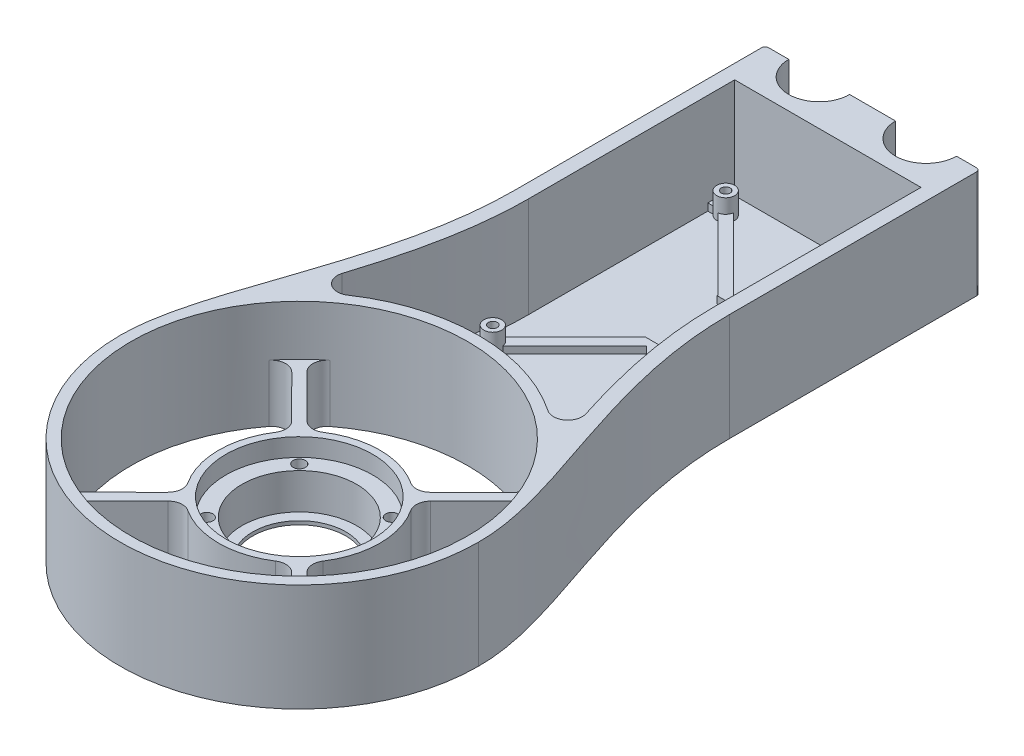
from build123d import *
from build123d.topology import SkipClean

# Parameters (mm, degrees)
EXTRUDE_1_DEPTH            = 30
CUT_EXTRUDE_1_DEPTH        = 209.32703380700454
SKETCH_3_R                 = 22.499999999999996
SKETCH_3_R_2               = 13.000000000000005
EXTRUDE_2_DEPTH            = 16
SKETCH_4_R                 = 20.499999999999996
CUT_EXTRUDE_2_DEPTH        = 5
SKETCH_5_R                 = 16.000000000000007
CUT_EXTRUDE_3_DEPTH        = 10
HOLE_WIZARD_M31_AT_2_COUNT = 2
HOLE_WIZARD_M31_AT_2_PITCH = 25.809397513308994
HOLE_WIZARD_M31_AT_3_COUNT = 2
HOLE_WIZARD_M31_AT_3_PITCH = 36.500000000000036
HOLE_WIZARD_M31_AT_4_COUNT = 2
HOLE_WIZARD_M31_AT_4_PITCH = 25.809397513308866
EXTRUDE_3_DEPTH            = 16
EXTRUDE_4_DEPTH            = 16
FILLET_1_R                 = 4
FILLET_2_R                 = 4
EXTRUDE_5_DEPTH            = 30
EXTRUDE_6_DEPTH            = 14
EXTRUDE_START              = -30
EXTRUDE_7_DEPTH            = 30
CUT_EXTRUDE_4_DEPTH        = 209.32703380700454
EXTRUDE_9_DEPTH            = 30
EXTRUDE_10_DEPTH           = 2
SKETCH_19_R                = 2.4999999999999996
SKETCH_19_R_2              = 2.5000000000000027
SKETCH_19_R_3              = 2.5
EXTRUDE_11_DEPTH           = 6
M3X0_51_D                  = 2.5
M3X0_51_DEPTH              = 6
M3X0_51_TIP                = 0.7510757737844503
EXTRUDE_12_DEPTH           = 2
CUT_EXTRUDE_5_DEPTH        = 209.32703380700454
SKETCH_24_W                = 52.00000000000009
SKETCH_24_H                = 1.5
EXTRUDE_14_DEPTH           = 28
EXTRUDE_15_DEPTH           = 20
FILLET_3_R                 = 1
M4X0_71_D                  = 3.3
M4X0_71_DEPTH              = 11
M4X0_71_TIP                = 0.9914200213954745


with BuildPart() as part:
    # Эскиз1 → Бобышка-Вытянуть1 (new body)
    with BuildSketch(Plane(origin=(0, 0, 0), x_dir=(1, 0, 0), z_dir=(0, 1, 0))):
        with BuildLine():
            Line((0, 0), (8.1, 0))
            ThreePointArc((8.1, 0), (15.1, -6.999999999999998), (22.099999999999998, 0))
            Line((22.099999999999998, 0), (37.900000000000006, 0))
            ThreePointArc((37.900000000000006, 0), (44.9, -6.999999999999993), (51.9, 0))
            Line((51.9, 0), (60, 0))
            Line((60, 0), (60, -50))
            add(Edge.make_bspline(
                [(60, -50), (60, -86.11635365077277), (80.16072899532094, -116.64260839857457), (80, -140)],
                knots=[0, 0, 0, 0, 1, 1, 1, 1], degree=3))
            ThreePointArc((80, -140), (29.99999999999999, -190), (-20.000000000000004, -140))
            add(Edge.make_bspline(
                [(0, -50), (0, -86.11635365077277), (-20.160728995320937, -116.64260839857457), (-20.000000000000004, -140)],
                knots=[0, 0, 0, 0, 1, 1, 1, 1], degree=3))
            Line((0, -50), (0, 0))
        make_face()
    extrude(amount=EXTRUDE_1_DEPTH)

    # Эскиз2 → Вырез-Вытянуть1 (cut, through all)
    with BuildSketch(Plane.XZ):
        with BuildLine():
            Line((2.9999999999996114, 50.000000000000114), (3, 3))
            Line((3, 3), (5.560607985830544, 3.0000000000000004))
            ThreePointArc((5.560607985830544, 3.0000000000000004), (15.1, 9.999999999999996), (24.639392014169452, 3))
            Line((24.639392014169452, 3), (35.36060798583055, 3.000000000000001))
            ThreePointArc((35.36060798583055, 3.000000000000001), (44.9, 9.999999999999995), (54.43939201416945, 3))
            Line((54.43939201416945, 3), (56.99999999999999, 3.0000000000000004))
            Line((56.99999999999999, 3.0000000000000004), (56.99999999999994, 49.99999999999999))
            add(Edge.make_bspline(
                [(56.99999999999994, 49.99999999999999), (56.99999999999994, 51.15761948444893), (57.04060731241555, 53.48144141430456), (57.273709046009905, 58.05633087995577), (57.8300620642797, 63.68575205723362), (58.85825492315023, 70.27885975955536), (60.62587825488197, 78.85472959222419), (63.42250232474483, 89.16282329635918), (67.22345269691876, 100.85676130834415), (70.98278726548295, 111.85118912341512), (73.6804257047586, 120.39952498600648), (75.34438659158211, 126.83896525591926), (76.29021877948448, 131.46025334650096), (76.78342190294313, 135.1232258543713), (76.97775852866553, 137.94836696867148), (77.00490381654205, 139.3043913040805), (76.99999885765412, 139.98963754557798)],
                knots=[0, 0, 0, 0, 0.0312549553320896, 0.0625099106641792, 0.1250198213283584, 0.18752973199253758, 0.2500396426567168, 0.37505946398507517, 0.5000792853134336, 0.6250991066417919, 0.7501189279701503, 0.8126288386343296, 0.8751387492985088, 0.937648659962688, 0.9689036152947776, 1.0001585706268672, 1.0001585706268672, 1.0001585706268672, 1.0001585706268672], degree=3))
            ThreePointArc((76.99999885765412, 139.98963754557798), (30.00000000005947, 186.99999999999946), (-16.999998857654578, 139.98963754569692))
            add(Edge.make_bspline(
                [(-16.999998857654578, 139.98963754569692), (-17.0049038165447, 139.30439130419938), (-16.977758528671707, 137.94836696879005), (-16.783421902957134, 135.1232258544892), (-16.290218779505096, 131.46025334661698), (-15.344386591609707, 126.83896525603217), (-13.680425704790268, 120.39952498611376), (-10.982787265517556, 111.85118912351331), (-7.223452696947435, 100.85676130842775), (-3.422502324765512, 89.16282329642603), (-0.6258782548946378, 78.85472959227457), (1.141745076844117, 70.27885975959141), (2.1699379357163426, 63.68575205725832), (2.7262909539885007, 58.056330879970524), (2.9593926875830268, 53.48144141431117), (2.999999999999611, 51.15761948445119), (2.9999999999996114, 50.000000000000114)],
                knots=[-0.00015857062870074, -0.00015857062870074, -0.00015857062870074, -0.00015857062870074, 0.03109638470344616, 0.06235134003559305, 0.12486125069988685, 0.18737116136418064, 0.24988107202847445, 0.37490089335706206, 0.49992071468564964, 0.6249405360142373, 0.7499603573428248, 0.8124702680071186, 0.8749801786714124, 0.9374900893357062, 0.9687450446678532, 1, 1, 1, 1], degree=3))
        make_face()
    extrude(amount=-CUT_EXTRUDE_1_DEPTH, mode=Mode.SUBTRACT)

    # Эскиз9 → Бобышка-Вытянуть3 (add)
    with SkipClean():  # the faces are left unmerged after this step: merging them gives an invalid solid
        with BuildSketch(Plane.XZ):
            with BuildLine():
                ThreePointArc((-10.590299410955694, 110.80363699425222), (29.999999999999805, 89.99999980965572), (70.59029941095437, 110.80363699425268))
                add(Edge.make_bspline(
                    [(70.59029941095437, 110.80363699425268), (70.69273970529326, 111.11282998358703), (71.96821202817121, 114.973824727998), (73.6804257047586, 120.39952498600648), (75.34438659158211, 126.83896525591926), (76.29021877948448, 131.46025334650096), (76.78342190294313, 135.1232258543713), (76.97775852866553, 137.94836696867148), (77.00490381654205, 139.3043913040805), (76.99999885765412, 139.98963754557798)],
                    knots=[0.6142510234253292, 0.6142510234253292, 0.6142510234253292, 0.6142510234253292, 0.6250991066417919, 0.7501189279701503, 0.8126288386343296, 0.8751387492985088, 0.937648659962688, 0.9689036152947776, 1.0001585706268672, 1.0001585706268672, 1.0001585706268672, 1.0001585706268672], degree=3))
                ThreePointArc((76.99999885765412, 139.98963754557798), (29.999999999940506, 93.00000000000031), (-16.999998857654358, 139.98963754569695))
                add(Edge.make_bspline(
                    [(-16.999998857654358, 139.98963754569695), (-17.0049038165447, 139.30439130419938), (-16.977758528671707, 137.94836696879005), (-16.783421902957134, 135.1232258544892), (-16.290218779505096, 131.46025334661698), (-15.344386591609707, 126.83896525603217), (-13.680425704790268, 120.39952498611376), (-11.96821202819517, 114.9738247280692), (-10.692739705305403, 111.11282998362088), (-10.590299410955694, 110.80363699425222)],
                    knots=[-0.00015857062870074, -0.00015857062870074, -0.00015857062870074, -0.00015857062870074, 0.03109638470344616, 0.06235134003559305, 0.12486125069988685, 0.18737116136418064, 0.24988107202847445, 0.37490089335706206, 0.3857489765746526, 0.3857489765746526, 0.3857489765746526, 0.3857489765746526], degree=3))
            make_face()
        extrude(amount=-EXTRUDE_3_DEPTH)



with BuildPart() as body_2:
    # Эскиз3 → Бобышка-Вытянуть2 (new body)
    with BuildSketch(Plane.XZ):
        with Locations(Location((30, 140, 0), (0, 0, 270))):
            Circle(SKETCH_3_R)
        with Locations(Location((30, 140, 0), (0, 0, 270))):
            Circle(SKETCH_3_R_2, mode=Mode.SUBTRACT)
    extrude(amount=-EXTRUDE_2_DEPTH)

    # Эскиз4 → Вырез-Вытянуть2 (cut)
    with BuildSketch(Plane(origin=(0, 16, 0), x_dir=(1, 0, 0), z_dir=(0, 1, 0))):
        with Locations(Location((30, -140, 0), (0, 0, 270))):
            Circle(SKETCH_4_R)
    extrude(amount=-CUT_EXTRUDE_2_DEPTH, mode=Mode.SUBTRACT)

    # Эскиз5 → Вырез-Вытянуть3 (cut)
    with BuildSketch(Plane(origin=(0, 11, 0), x_dir=(1, 0, 0), z_dir=(0, 1, 0))):
        with Locations(Location((30, -140, 0), (0, 0, 270))):
            Circle(SKETCH_5_R)
    extrude(amount=-CUT_EXTRUDE_3_DEPTH, mode=Mode.SUBTRACT)

    # Эскиз7 → Отверстие с зазором M31 (revolve, cut)
    with BuildSketch(Plane(origin=(17.09530124334549, 11, 127.0953012433455), x_dir=(0, 0, 1), z_dir=(1, 0, 0))):
        Polygon((0, 0), (-2.69e-15, 11), (1.6999999999999966, 11), (1.699999999999988, -1.35e-15), align=None)
    hole_wizard_m31 = revolve(axis=Axis((17.09530124334549, 17.34999999999999, 127.0953012433455), (0, -1, 0)), mode=Mode.SUBTRACT)

    # Отверстие с зазором M31 at 2: Отверстие с зазором M31 ×2
    with Locations(*[(i * HOLE_WIZARD_M31_AT_2_PITCH, 0, 0) for i in range(1, HOLE_WIZARD_M31_AT_2_COUNT)]):
        add(hole_wizard_m31, mode=Mode.SUBTRACT)

    # Отверстие с зазором M31 at 3: Отверстие с зазором M31 ×2
    with Locations(*[Vector(0.7071067811865477, 0, 0.7071067811865475) * (i * HOLE_WIZARD_M31_AT_3_PITCH) for i in range(1, HOLE_WIZARD_M31_AT_3_COUNT)]):
        add(hole_wizard_m31, mode=Mode.SUBTRACT)

    # Отверстие с зазором M31 at 4: Отверстие с зазором M31 ×2
    with Locations(*[(0, 0, i * HOLE_WIZARD_M31_AT_4_PITCH) for i in range(1, HOLE_WIZARD_M31_AT_4_COUNT)]):
        add(hole_wizard_m31, mode=Mode.SUBTRACT)


with BuildPart() as part_1:
    with SkipClean():  # the faces are left unmerged after this step: merging them gives an invalid solid
        add(part.part)

        add(body_2.part)  # Бобышка-Вытянуть4 merges body 2
        # Эскиз10 → Бобышка-Вытянуть4 (add)
        with BuildSketch(Plane.XZ):
            with BuildLine():
                Line((13.061566249620322, 154.8101135067898), (-4.284838091164062, 172.14887054101078))
                ThreePointArc((-4.284838091164062, 172.14887054101078), (-3.2412744710281274, 173.22676137606223), (-2.163839456664804, 174.27079560509063))
                Line((-2.163839456664804, 174.27079560509063), (15.182490993971593, 156.93196464844726))
                ThreePointArc((15.182490993971593, 156.93196464844726), (14.086623923443979, 155.90642831832764), (13.061566249620322, 154.8101135067898))
            make_face()
            with BuildLine():
                Line((15.189886493210187, 123.06156624962034), (-2.148870541010764, 105.71516190883595))
                ThreePointArc((-2.148870541010764, 105.71516190883595), (-3.2267613760621217, 106.75872552897181), (-4.270795605090482, 107.83616054333508))
                Line((-4.270795605090482, 107.83616054333508), (13.06803535155281, 125.18249099397156))
                ThreePointArc((13.06803535155281, 125.18249099397156), (14.093571681672403, 124.08662392344398), (15.189886493210187, 123.06156624962034))
            make_face()
            with BuildLine():
                Line((44.81011350678981, 156.9384337503797), (62.148870541010766, 174.28483809116406))
                ThreePointArc((62.148870541010766, 174.28483809116406), (63.226761376062264, 173.2412744710281), (64.27079560509073, 172.1638394566647))
                Line((64.27079560509073, 172.1638394566647), (46.931964648447305, 154.81750900602833))
                ThreePointArc((46.931964648447305, 154.81750900602833), (45.906428318327656, 155.91337607655598), (44.81011350678981, 156.9384337503797))
            make_face()
            with BuildLine():
                Line((46.93843375037968, 125.18988649321022), (64.28483809116408, 107.85112945898926))
                ThreePointArc((64.28483809116408, 107.85112945898926), (63.24127447102802, 106.77323862393771), (62.163839456664554, 105.72920439490919))
                Line((62.163839456664554, 105.72920439490919), (44.81750900602827, 123.06803535155267))
                ThreePointArc((44.81750900602827, 123.06803535155267), (45.91337607655595, 124.09357168167234), (46.93843375037968, 125.18988649321022))
            make_face()
        extrude(amount=-EXTRUDE_4_DEPTH)

    # Скругление1
    fillet_1_edges = [part_1.edges().sort_by_distance(p)[0] for p in [
        (70.59029941095437, 8, 110.80363699425268),
        (-10.590299410955694, 8, 110.80363699425222),
    ]]
    fillet(fillet_1_edges, radius=FILLET_1_R)

    # Скругление2
    fillet_2_edges = [part_1.edges().sort_by_distance(p)[0] for p in [
        (13.068035351552812, 8, 125.18249099397156),
        (-4.270795605090485, 8, 107.83616054333507),
        (13.06156624962032, 8, 154.8101135067898),
        (-4.284838091164065, 8, 172.14887054101078),
        (-2.163839456664807, 8, 174.27079560509063),
        (15.18249099397159, 8, 156.93196464844726),
        (44.81011350678982, 8, 156.9384337503797),
        (62.148870541010766, 8, 174.28483809116406),
        (46.931964648447305, 8, 154.81750900602833),
        (64.27079560509073, 8, 172.1638394566647),
        (46.93843375037968, 8, 125.18988649321022),
        (64.28483809116409, 8, 107.85112945898926),
        (44.81750900602827, 8, 123.06803535155267),
        (15.189886493210189, 8, 123.06156624962034),
        (-2.1488705410107665, 8, 105.71516190883595),
        (62.16383945666456, 8, 105.72920439490917),
    ]]
    fillet(fillet_2_edges, radius=FILLET_2_R)

    # Эскиз11 → Бобышка-Вытянуть5 (add, through all)
    with BuildSketch(Plane(origin=(0, 30, 0), x_dir=(1, 0, 0), z_dir=(0, 1, 0))):
        with BuildLine():
            ThreePointArc((24.639392014169456, -3.000000000000001), (21.016079755907775, -8.062257768251904), (15.099999932545344, -9.999999999999998))
            Line((15.099999932545344, -9.999999999999998), (44.90000001649191, -9.999999999999998))
            ThreePointArc((44.90000001649191, -9.999999999999995), (38.98392022354849, -8.062257753176917), (35.36060798583055, -3.0000000000000004))
            Line((35.36060798583055, -3.000000000000001), (24.639392014169452, -2.9999999999999996))
        make_face()
        with BuildLine():
            ThreePointArc((54.43939201416945, -3.0000000000000013), (50.81607978974771, -8.062257743420174), (44.90000001649191, -9.999999999999995))
            Line((44.90000001649191, -9.999999999999998), (56.99999999999999, -9.999999999999998))
            Line((56.99999999999999, -9.999999999999998), (56.99999999999999, -3.0000000000000004))
            Line((56.99999999999999, -3.0000000000000004), (54.43939201416945, -3.0000000000000004))
        make_face()
        with BuildLine():
            Line((3.000000000000001, -3.0000000000000027), (3.000000000000001, -9.999999999999998))
            Line((3.000000000000001, -9.999999999999998), (15.099999932545344, -9.999999999999998))
            ThreePointArc((15.099999932545344, -9.999999999999998), (9.183920189708545, -8.062257728345193), (5.560607985830545, -3.0000000000000004))
            Line((5.560607985830544, -3.0000000000000004), (3.000000000000001, -3.0000000000000027))
        make_face()
    extrude(amount=-EXTRUDE_5_DEPTH)

    # Эскиз12 → Бобышка-Вытянуть6 (add)
    with BuildSketch(Plane(origin=(0, 16, 0), x_dir=(1, 0, 0), z_dir=(0, 1, 0))):
        with BuildLine():
            ThreePointArc((59.169351437259884, -99.39028495835034), (29.999999999999602, -89.99999980965637), (0.8306485627394624, -99.3902849583508))
            ThreePointArc((0.8306485627394624, -99.3902849583508), (-3.85522262964213, -99.3767165856445), (-5.312887214055651, -94.9233148642998))
            add(Edge.make_bspline(
                [(-5.312887214055651, -94.9233148642998), (-5.9422377396764325, -96.89165480215911), (-7.843811241520206, -102.67104176508077), (-10.982787265517556, -111.85118912351331), (-13.680425704790268, -120.39952498611376), (-15.344386591609707, -126.83896525603217), (-16.290218779505096, -131.46025334661698), (-16.783421902957134, -135.1232258544892), (-16.977758528671707, -137.94836696879005), (-17.0049038165447, -139.30439130419938), (-16.999998857654905, -139.98963754569692)],
                knots=[-0.00015857062870074, -0.00015857062870074, -0.00015857062870074, -0.00015857062870074, 0.06296962095463947, 0.18798944228322703, 0.3130092636118147, 0.3755191742761085, 0.43802908494040227, 0.5005389956046961, 0.531793950936843, 0.5630489062689898, 0.5630489062689898, 0.5630489062689898, 0.5630489062689898], degree=3))
            ThreePointArc((-16.999998857654905, -139.98963754569692), (29.99999999994054, -93.00000000000054), (76.99999885765412, -139.98963754557798))
            add(Edge.make_bspline(
                [(76.99999885765412, -139.98963754557798), (77.00490381654205, -139.3043913040805), (76.97775852866553, -137.94836696867148), (76.78342190294313, -135.1232258543713), (76.29021877948448, -131.46025334650096), (75.34438659158211, -126.83896525591926), (73.6804257047586, -120.39952498600648), (70.98278726548295, -111.85118912341512), (67.84381124149854, -102.6710417650181), (65.94223773966665, -96.8916548021302), (65.31288721405492, -94.92331486429931)],
                knots=[0.43695109373100594, 0.43695109373100594, 0.43695109373100594, 0.43695109373100594, 0.4682060490630955, 0.49946100439518515, 0.5619709150593644, 0.6244808257235436, 0.6869907363877228, 0.8120105577160812, 0.9370303790444395, 1.0001585706268672, 1.0001585706268672, 1.0001585706268672, 1.0001585706268672], degree=3))
            ThreePointArc((65.31288721405492, -94.92331486429931), (63.85522262964144, -99.37671658564399), (59.169351437259884, -99.39028495835034))
        make_face()
    extrude(amount=EXTRUDE_6_DEPTH)

    # Эскиз13 → Бобышка-Вытянуть7 (add)
    with BuildSketch(Plane(origin=(0, 30, 0), x_dir=(1, 0, 0), z_dir=(0, 1, 0)).offset(EXTRUDE_START)):
        with BuildLine():
            Line((3.9999999999992784, -50.0000000000001), (3.999999999999895, -10.999999999999996))
            Line((3.999999999999895, -10.999999999999996), (55.99999999999998, -10.999999999999996))
            Line((55.99999999999998, -10.999999999999996), (55.99999999999991, -49.99999999999998))
            add(Edge.make_bspline(
                [(55.99999999999991, -49.99999999999998), (55.99999999999991, -52.03498068113325), (56.12527058577417, -56.13193535820143), (56.819212399121525, -64.08850039677553), (58.41081044935653, -73.7477782372734), (60.67836350111951, -82.95184755755167), (62.73749964431051, -90.06762105355448), (63.80856926980304, -93.50200234801329), (64.36039029638012, -95.22786309007068)],
                knots=[0, 0, 0, 0, 0.05461888671637527, 0.10923777343275054, 0.21847554686550108, 0.3277133202982516, 0.3823322070146269, 0.43695109373100216, 0.43695109373100216, 0.43695109373100216, 0.43695109373100216], degree=3))
            Line((64.36039029638012, -95.22786309007068), (65.16614916399801, -97.74793305879278))
            ThreePointArc((65.16614916399801, -97.74793305879278), (65.49751290253572, -96.34902670789218), (65.31288721405492, -94.92331486429931))
            add(Edge.make_bspline(
                [(56.99999999999994, -49.99999999999999), (56.99999999999994, -51.15761948444893), (57.04060731241555, -53.48144141430456), (57.273709046009905, -58.05633087995577), (57.8300620642797, -63.68575205723362), (58.85825492315023, -70.27885975955536), (60.62587825488197, -78.85472959222419), (62.8576452702698, -87.08081323654591), (64.69586447452805, -92.9935309818117), (65.31288721405492, -94.92331486429931)],
                knots=[0, 0, 0, 0, 0.0312549553320896, 0.0625099106641792, 0.1250198213283584, 0.18752973199253758, 0.2500396426567168, 0.37505946398507517, 0.436951093731006, 0.436951093731006, 0.436951093731006, 0.436951093731006], degree=3))
            Line((56.99999999999994, -49.99999999999999), (56.999999999999986, -9.999999999999998))
            Line((56.999999999999986, -9.999999999999998), (2.9999999999999423, -9.999999999999995))
            Line((2.9999999999999423, -9.999999999999995), (2.9999999999996114, -50.000000000000114))
            add(Edge.make_bspline(
                [(-5.312887214055668, -94.92331486429987), (-4.695864474535626, -92.99353098183356), (-2.857645270281727, -87.08081323658317), (-0.6258782548946378, -78.85472959227457), (1.141745076844117, -70.27885975959141), (2.1699379357163426, -63.68575205725832), (2.7262909539885007, -58.056330879970524), (2.9593926875830268, -53.48144141431117), (2.999999999999611, -51.15761948445119), (2.9999999999996114, -50.000000000000114)],
                knots=[0.5630489062689893, 0.5630489062689893, 0.5630489062689893, 0.5630489062689893, 0.6249405360142373, 0.7499603573428248, 0.8124702680071186, 0.8749801786714124, 0.9374900893357062, 0.9687450446678532, 1, 1, 1, 1], degree=3))
            ThreePointArc((-5.312887214055668, -94.92331486429987), (-5.497512902536842, -96.34902670789286), (-5.166149163999231, -97.74793305879379))
            Line((-5.166149163999231, -97.74793305879379), (-4.360390296381386, -95.22786309007161))
            add(Edge.make_bspline(
                [(-4.360390296381386, -95.22786309007161), (-3.8085692698043276, -93.50200234801419), (-2.737499644311918, -90.06762105355533), (-0.6783635011204932, -82.95184755755248), (1.5891895506421023, -73.74777823727402), (3.1807876008779727, -64.08850039677573), (3.8747294142246784, -56.131935358201844), (3.99999999999928, -52.03498068113343), (3.9999999999992784, -50.0000000000001)],
                knots=[0.5630489062689885, 0.5630489062689885, 0.5630489062689885, 0.5630489062689885, 0.6176677929853649, 0.6722866797017414, 0.7815244531344943, 0.8907622265672471, 0.9453811132836236, 1, 1, 1, 1], degree=3))
        make_face()
    extrude(amount=EXTRUDE_7_DEPTH)

    # Эскиз14 → Вырез-Вытянуть4 (cut, through all)
    with BuildSketch(Plane(origin=(0, 30, 0), x_dir=(1, 0, 0), z_dir=(0, 1, 0))):
        with BuildLine():
            Line((3.9999999999992784, -50.0000000000001), (55.99999999999991, -49.99999999999998))
            add(Edge.make_bspline(
                [(55.99999999999991, -49.99999999999998), (55.99999999999991, -52.03498068113325), (56.12527058577417, -56.13193535820143), (56.819212399121525, -64.08850039677553), (58.41081044935653, -73.7477782372734), (60.67836350111951, -82.95184755755167), (62.73749964431051, -90.06762105355448), (63.80856926980304, -93.50200234801329), (64.36039029638012, -95.22786309007068)],
                knots=[0, 0, 0, 0, 0.05461888671637527, 0.10923777343275054, 0.21847554686550108, 0.3277133202982516, 0.3823322070146269, 0.43695109373100216, 0.43695109373100216, 0.43695109373100216, 0.43695109373100216], degree=3))
            Line((64.36039029638012, -95.22786309007068), (68.45994864398439, -108.0495325646643))
            ThreePointArc((68.45994864398439, -108.0495325646643), (30.00000000000027, -89.99999980965637), (-8.459948643984049, -108.04953256466388))
            Line((-8.459948643984049, -108.04953256466388), (-4.360390296381386, -95.22786309007161))
            add(Edge.make_bspline(
                [(-4.360390296381386, -95.22786309007161), (-3.8085692698043276, -93.50200234801419), (-2.737499644311918, -90.06762105355533), (-0.6783635011204932, -82.95184755755248), (1.5891895506421023, -73.74777823727402), (3.1807876008779727, -64.08850039677573), (3.8747294142246784, -56.131935358201844), (3.99999999999928, -52.03498068113343), (3.9999999999992784, -50.0000000000001)],
                knots=[0.5630489062689885, 0.5630489062689885, 0.5630489062689885, 0.5630489062689885, 0.6176677929853649, 0.6722866797017414, 0.7815244531344943, 0.8907622265672471, 0.9453811132836236, 1, 1, 1, 1], degree=3))
        make_face()
    extrude(amount=-CUT_EXTRUDE_4_DEPTH, mode=Mode.SUBTRACT)

    # Эскиз15 → Бобышка-Вытянуть9 (add)
    with BuildSketch(Plane(origin=(0, 30, 0), x_dir=(1, 0, 0), z_dir=(0, 1, 0))):
        with BuildLine():
            Line((-4.360390296381386, -95.22786309007161), (-8.459948643984049, -108.04953256466388))
            ThreePointArc((-8.459948643984049, -108.04953256466388), (-3.5312054010374823, -102.91013233526172), (2.0776304150828864, -98.52300281122487))
            ThreePointArc((2.07763041508289, -98.52300281122487), (-2.5353445930742455, -98.42034842289144), (-3.9825043477067164, -94.03904667638977))
            add(Edge.make_bspline(
                [(-4.360390296381386, -95.22786309007161), (-4.233592316694429, -94.83129310673598), (-4.107654237723681, -94.43518089835217), (-3.98250434770692, -94.03904667639037)],
                knots=[0.5630489062689885, 0.5630489062689885, 0.5630489062689885, 0.5630489062689885, 0.5755992879232479, 0.5755992879232479, 0.5755992879232479, 0.5755992879232479], degree=3))
        make_face()
        with BuildLine():
            Line((68.45994864398439, -108.04953256466429), (64.36039029638012, -95.22786309007068))
            add(Edge.make_bspline(
                [(63.98253813414828, -94.03915361981963), (64.10767690386872, -94.43525219001346), (64.23360372714463, -94.83132879375911), (64.36039029638012, -95.22786309007068)],
                knots=[0.4244018414758169, 0.4244018414758169, 0.4244018414758169, 0.4244018414758169, 0.43695109373100216, 0.43695109373100216, 0.43695109373100216, 0.43695109373100216], degree=3))
            ThreePointArc((63.982538134148065, -94.03915361981899), (62.535301459710944, -98.42038247928511), (57.922370806697025, -98.52300363372812))
            ThreePointArc((57.92237080669703, -98.52300363372812), (63.53120594731209, -102.91013282912289), (68.45994864398439, -108.04953256466429))
        make_face()
    extrude(amount=-EXTRUDE_9_DEPTH)

    # Эскиз16 → Бобышка-Вытянуть10 (add)
    with BuildSketch(Plane.XZ):
        Polygon((-7.8524647657984, 101.93517402749758), (-2.0682379994428626, 81.42746094678252), (2.4013917745591415, 58.81639267830183), (2.4013917745591415, 39.097437792998896), (2.4013917745591415, 22.53351568934444), (2.4013917745591415, 9.387545765809158), (57.35154605493661, 9.387545765809158), (57.35154605493661, 36.73116320676255), (57.35154605493661, 56.975956889006895), (62.60993402435075, 81.42746094678252), (67.0201949019239, 101.93517402749758), (62.60993402435075, 101.93517402749758), (57.35154605493661, 100.89572524284594), (53.10461288062748, 97.8523070484284), (47.493444525620525, 95.40639704359529), (40.92861683359864, 92.5447866416201), (34.93130146834046, 92.5447866416201), (28.840892836007253, 91.3408686561589), (21.73358788745398, 92.86932133326714), (13.415834781085877, 94.65808544216351), (5.092688811679992, 97.8523070484284), (-1.046943422200762, 101.93517402749758), align=None)
    extrude(amount=-EXTRUDE_10_DEPTH)

    # Эскиз19 → Бобышка-Вытянуть11 (add)
    with BuildSketch(Plane(origin=(0, 2, 0), x_dir=(1, 0, 0), z_dir=(0, 1, 0))):
        with Locations(Location((7.499999999999693, -18.499999999999996, 0), (0, 0, 90))):
            Circle(SKETCH_19_R)
        with Locations(Location((52.4999999999997, -18.499999999999996, 0), (0, 0, 90))):
            Circle(SKETCH_19_R_2)
        with Locations(Location((52.49999999999971, -63.5, 0), (0, 0, 90))):
            Circle(SKETCH_19_R_2)
        with Locations(Location((7.499999999999699, -63.5, 0), (0, 0, 90))):
            Circle(SKETCH_19_R_3)
    extrude(amount=EXTRUDE_11_DEPTH)

    # Отверстие обработанное метчиком M3x0.51
    with Locations(Plane(origin=(0, 8, 0), x_dir=(1, 0, 0), z_dir=(0, 1, 0))):
        with Locations((7.5, -18.5), (52.5, -18.5), (52.5, -63.5), (7.5, -63.5)):
            Hole(M3X0_51_D / 2, depth=M3X0_51_DEPTH)
            with Locations((0, 0, -(M3X0_51_DEPTH + M3X0_51_TIP / 2))):  # 118° drill point
                Cone(0, M3X0_51_D / 2, M3X0_51_TIP, mode=Mode.SUBTRACT)

    # Эскиз22 → Бобышка-Вытянуть12 (add)
    with BuildSketch(Plane(origin=(0, 2, 0), x_dir=(1, 0, 0), z_dir=(0, 1, 0))):
        with BuildLine():
            ThreePointArc((9.97487373415261, -18.85355339059327), (9.267766952966062, -20.267766952966365), (7.853553390592965, -20.974873734152915))
            Line((7.853553390592965, -20.974873734152915), (27.878679656440053, -41.00000000000001))
            Line((27.878679656440053, -41.00000000000001), (7.853553390592972, -61.02512626584708))
            ThreePointArc((7.853553390592972, -61.02512626584708), (9.26776695296607, -61.73223304703363), (9.974873734152618, -63.14644660940673))
            Line((9.974873734152617, -63.14644660940673), (29.999999999999694, -43.12132034355966))
            Line((29.999999999999694, -43.12132034355966), (50.02512626584679, -63.146446609406745))
            ThreePointArc((50.02512626584679, -63.146446609406745), (50.732233047033326, -61.732233047033645), (52.14644660940642, -61.025126265847085))
            Line((52.14644660940642, -61.02512626584708), (32.12132034355934, -41))
            Line((32.12132034355934, -41), (52.14644660940643, -20.97487373415292))
            ThreePointArc((52.14644660940643, -20.974873734152915), (50.73223304703333, -20.26776695296637), (50.02512626584679, -18.853553390593273))
            Line((50.02512626584679, -18.853553390593273), (29.999999999999705, -38.87867965644036))
            Line((29.99999999999971, -38.87867965644036), (9.974873734152608, -18.85355339059327))
        make_face()
        with BuildLine():
            Line((3.999999999999776, -19.999999999999996), (5.4999999999996945, -19.999999999999996))
            ThreePointArc((5.4999999999996945, -19.999999999999996), (4.9999999999996945, -18.499999999999993), (5.499999999999696, -16.999999999999993))
            Line((5.4999999999996945, -16.999999999999993), (3.999999999999776, -16.999999999999993))
            Line((3.999999999999776, -16.999999999999993), (3.999999999999776, -19.999999999999996))
        make_face()
        with BuildLine():
            ThreePointArc((5.499999999999707, -65.00000000000001), (4.999999999999698, -63.500000000000014), (5.4999999999996865, -62.000000000000014))
            Line((5.499999999999686, -62.000000000000014), (3.3150022080520247, -62.000000000000234))
            add(Edge.make_bspline(
                [(2.940902429424268, -65.00000000033711), (3.0739080344752345, -64.03161035225473), (3.199237612352327, -63.03166786483183), (3.3120087197819035, -62.02675817436333), (3.315002208008357, -62.00000000039057)],
                knots=[0.8636467637840218, 0.8636467637840218, 0.8636467637840218, 0.8636467637840218, 0.8907622265672471, 0.8915038922890043, 0.8915038922890043, 0.8915038922890043, 0.8915038922890043], degree=3))
            Line((2.9409024294705666, -65.00000000000001), (5.499999999999707, -65.00000000000001))
        make_face()
        with BuildLine():
            Line((55.999999999999964, -16.999999999999993), (54.4999999999997, -16.999999999999993))
            ThreePointArc((54.4999999999997, -16.999999999999993), (54.9999999999997, -18.499999999999996), (54.4999999999997, -20))
            Line((54.4999999999997, -19.999999999999996), (55.999999999999964, -19.999999999999996))
            Line((55.999999999999964, -19.999999999999996), (55.999999999999964, -16.999999999999993))
        make_face()
        with BuildLine():
            ThreePointArc((54.49999999999973, -62.00000000000002), (54.99999999999971, -63.50000000000002), (54.4999999999997, -65.00000000000001))
            Line((54.4999999999997, -65.00000000000001), (57.059097570528714, -65.00000000000001))
            add(Edge.make_bspline(
                [(56.684997791955496, -62.00000000007417), (56.687991280193664, -62.02675817415233), (56.80076238762177, -63.03166786461972), (56.92609196549733, -64.03161035204154), (57.05909757053132, -65.00000000001907)],
                knots=[0.10849610770807283, 0.10849610770807283, 0.10849610770807283, 0.10849610770807283, 0.10923777343275054, 0.13635323621300985, 0.13635323621300985, 0.13635323621300985, 0.13635323621300985], degree=3))
            Line((56.684997791947225, -62.000000000000206), (54.49999999999972, -62.000000000000014))
        make_face()
    extrude(amount=EXTRUDE_12_DEPTH)

    # Эскиз23 → Вырез-Вытянуть5 (cut, through all)
    with BuildSketch(Plane(origin=(0, 30, 0), x_dir=(1, 0, 0), z_dir=(0, 1, 0))):
        with BuildLine():
            Line((8.1, 0), (6.6, 1.04e-15))
            ThreePointArc((6.6, 1.04e-15), (15.099999999999998, -8.5), (23.599999999999994, 0))
            Line((23.599999999999994, 0), (22.099999999999998, 4.3e-16))
            ThreePointArc((22.099999999999998, 4.3e-16), (15.099999999999998, -7), (8.1, 0))
        make_face()
        with BuildLine():
            Line((53.39999999999999, -2.08e-15), (51.89999999999999, -4.3e-16))
            ThreePointArc((51.89999999999999, -4.3e-16), (44.9, -6.999999999999993), (37.900000000000006, 0))
            Line((37.900000000000006, 0), (36.4, 1.04e-15))
            ThreePointArc((36.4, 1.04e-15), (44.9, -8.5), (53.39999999999999, -2.08e-15))
        make_face()
    extrude(amount=-CUT_EXTRUDE_5_DEPTH, mode=Mode.SUBTRACT)

    # Эскиз24 → Бобышка-Вытянуть14 (add)
    with BuildSketch(Plane(origin=(0, 2, 0), x_dir=(1, 0, 0), z_dir=(0, 1, 0))):
        with Locations((29.99999999999994, -11.749999999999996)):
            Rectangle(SKETCH_24_W, SKETCH_24_H)
    extrude(amount=EXTRUDE_14_DEPTH)


with BuildPart() as body_2_2:
    # Split Bodies 1: the piece on the far side of the plane
    add(part_1.part)
    split(bisect_by=Plane(origin=(0, 0, 41.123183465185825), x_dir=(-1, 0, 0), z_dir=(0, 0, -1)), keep=Keep.BOTTOM)


with BuildPart() as part_2:
    add(part_1.part)

    # Split Bodies 1
    split(bisect_by=Plane(origin=(0, 0, 41.123183465185825), x_dir=(-1, 0, 0), z_dir=(0, 0, -1)), keep=Keep.TOP)


with BuildPart() as part_3:
    # Move Body 1: read off the stored shape, not the designer's step
    # Move Body 1: moved
    add(part_2.part.moved(Location((0, 0, -20))))


    add(body_2_2.part)  # Бобышка-Вытянуть15 merges body 2 2
    # Эскиз27 → Бобышка-Вытянуть15 (add)
    with BuildSketch(Plane(origin=(0, 0, 41.123183465185825), x_dir=(-1, 0, 0), z_dir=(0, 0, -1))):
        Polygon((-60, 0), (0, 0), (0, 30), (-3.999999999999419, 30), (-3.999999999999419, 2.0000000000000018), (-55.99999999999992, 2.0000000000000018), (-55.99999999999992, 30), (-60, 30), align=None)
    extrude(amount=EXTRUDE_15_DEPTH)

    # Скругление3
    fillet_3_edges = [part_3.edges().sort_by_distance(p)[0] for p in [
        (0, 15, -20),
        (60, 15, -20),
    ]]
    fillet(fillet_3_edges, radius=FILLET_3_R)

    # Отверстие обработанное метчиком M4x0.71
    with Locations(Plane(origin=(0, 0, -20.000000000000004), x_dir=(-1, 0, 0), z_dir=(0, 0, -1))):
        with Locations((-55.75, 25), (-30, 25), (-4.25, 25), (-4.25, 5), (-30, 5), (-55.75, 5)):
            Hole(M4X0_71_D / 2, depth=M4X0_71_DEPTH)
            with Locations((0, 0, -(M4X0_71_DEPTH + M4X0_71_TIP / 2))):  # 118° drill point
                Cone(0, M4X0_71_D / 2, M4X0_71_TIP, mode=Mode.SUBTRACT)


solid = part_3.part
